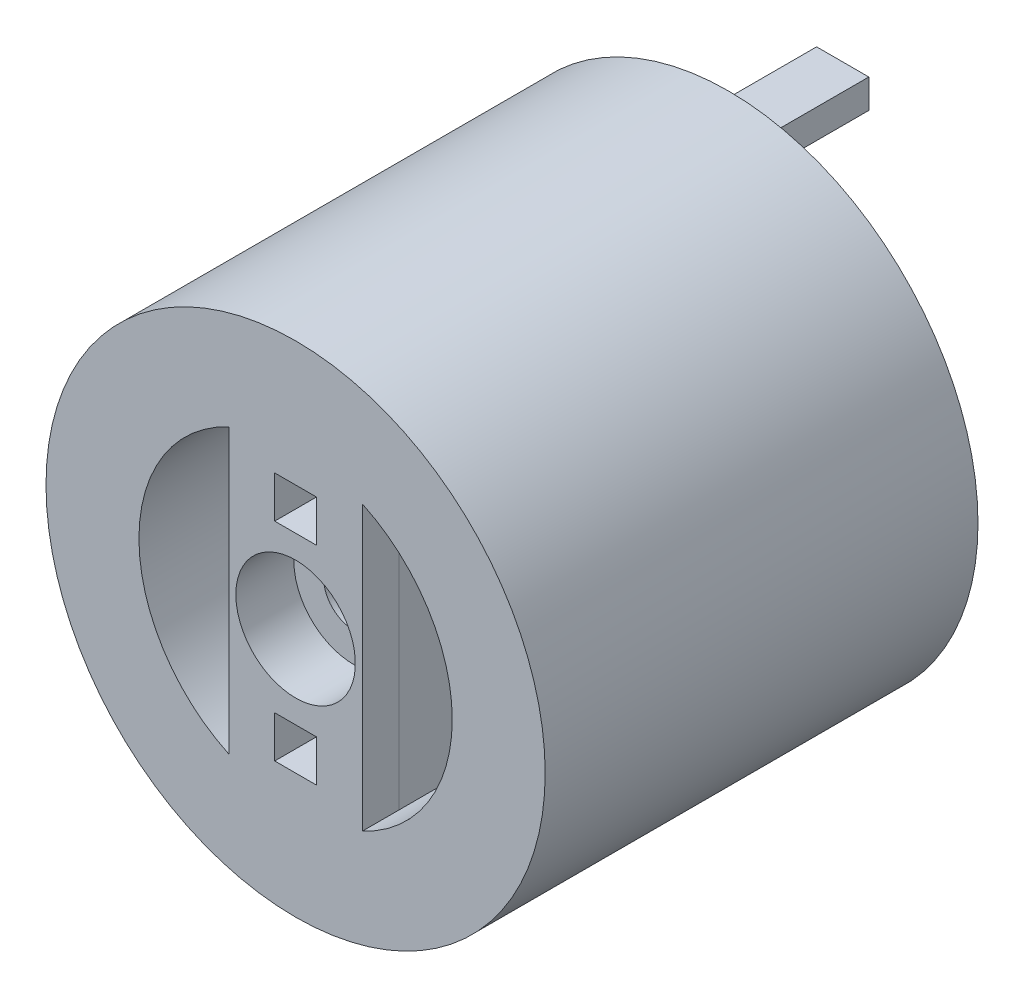
from build123d import *

# Parameters (mm, degrees)
SKETCH1_R                       = 21.51
BOSS_EXTRUDE1_DEPTH             = 37.3
SKETCH1_4_W                     = 4.5
SKETCH1_4_H                     = 2.5
BOSS_EXTRUDE2_DEPTH             = 9.85
CIRPATTERN2_COUNT               = 2
SKETCH4_W                       = 11.5
SKETCH4_H                       = 38.336712536
BOSS_EXTRUDE3_DEPTH             = 3.175
SKETCH8_W                       = 11.49524473
SKETCH8_H                       = 32.96460859
SKETCH8_R                       = 2.5875
BOSS_EXTRUDE4_DEPTH             = 5
CUT_EXTRUDE1_DEPTH              = 23
CIRPATTERN1_COUNT               = 2
CIRPATTERN1_ANGLE               = 53
CIRPATTERN1_THE_OTHER_WAY_COUNT = 2
CIRPATTERN1_THE_OTHER_WAY_ANGLE = 53
MIRROR2_COPY_1_DEPTH            = 23
MIRROR2_COPY_2_DEPTH            = 23
MIRROR2_COPY_3_DEPTH            = 23
CUT_EXTRUDE2_DEPTH              = 57.111341991
CUT_EXTRUDE2_DEPTH_BACK         = 5
SKETCH7_R                       = 5.15
CUT_EXTRUDE21_DEPTH             = 29


with BuildPart() as part:
    # Sketch1 → Boss-Extrude1 (new body)
    with BuildSketch(Plane.XY):
        Circle(SKETCH1_R)
        with BuildLine():
            ThreePointArc((0, 13.500344823), (9.546185373, 9.546185373), (13.500344823, 0))
            ThreePointArc((13.500344823, 0), (9.546185373, -9.546185373), (0, -13.500344823))
            ThreePointArc((0, -13.500344823), (-13.500344823, 0), (0, 13.500344823))
        make_face(mode=Mode.SUBTRACT)
    extrude(amount=BOSS_EXTRUDE1_DEPTH)

    # Sketch1<4> → Boss-Extrude2 (add)
    with BuildSketch(Plane.XY):
        with Locations((0, 17.500344823)):
            Rectangle(SKETCH1_4_W, SKETCH1_4_H)
    boss_extrude2 = extrude(amount=-BOSS_EXTRUDE2_DEPTH)

    # CirPattern2: Boss-Extrude2 ×2 about axis
    cirpattern2_axis = Axis((0, 0, 26.501422175), (0, 0, -1))
    for i in range(1, CIRPATTERN2_COUNT):
        add(boss_extrude2.rotate(cirpattern2_axis, i * 360 / CIRPATTERN2_COUNT))

    # Sketch4 → Boss-Extrude3 (add)
    with BuildSketch(Plane.XY.offset(37.3)):
        Rectangle(SKETCH4_W, SKETCH4_H)
    extrude(amount=-BOSS_EXTRUDE3_DEPTH)

    # Sketch8 → Boss-Extrude4 (add)
    with BuildSketch(Plane.XY.offset(34.125)):
        Rectangle(SKETCH8_W, SKETCH8_H)
        Circle(SKETCH8_R, mode=Mode.SUBTRACT)
    extrude(amount=-BOSS_EXTRUDE4_DEPTH)

    # Sketch1<3> → Cut-Extrude1 (cut)
    with BuildSketch(Plane.XY):
        Polygon((14.534826762, 4.999881098), (14.500344823, 0), (14.465862885, -4.999881098), (19.465743983, -5.034363037), (19.53470786, 4.96539916), align=None)
    cut_extrude1 = extrude(amount=CUT_EXTRUDE1_DEPTH, mode=Mode.SUBTRACT)

    # CirPattern1: Cut-Extrude1 ×2 about axis
    cirpattern1_axis = Axis((0, 0, 26.501422175), (0, 0, 1))
    for i in range(1, CIRPATTERN1_COUNT):
        add(cut_extrude1.rotate(cirpattern1_axis, i * CIRPATTERN1_ANGLE / (CIRPATTERN1_COUNT - 1)), mode=Mode.SUBTRACT)

    # CirPattern1 the other way: Cut-Extrude1 ×2 about axis
    cirpattern1_the_other_way_axis = Axis((0, 0, 26.501422175), (0, 0, -1))
    for i in range(1, CIRPATTERN1_THE_OTHER_WAY_COUNT):
        add(cut_extrude1.rotate(cirpattern1_the_other_way_axis, i * CIRPATTERN1_THE_OTHER_WAY_ANGLE / (CIRPATTERN1_THE_OTHER_WAY_COUNT - 1)), mode=Mode.SUBTRACT)

    # Mirror2 copy 1 sketch → Mirror2 copy 1 (cut)
    with BuildSketch(Plane(origin=(0, 0, 0), x_dir=(-0.6018150231520466, 0.798635510047294, 0), z_dir=(0, 0, 1))):
        Polygon((14.534826762, -4.999881098), (14.500344823, 0), (14.465862885, 4.999881098), (19.465743983, 5.034363037), (19.53470786, -4.96539916), align=None)
    extrude(amount=MIRROR2_COPY_1_DEPTH, mode=Mode.SUBTRACT)

    # Mirror2 copy 2 sketch → Mirror2 copy 2 (cut)
    with BuildSketch(Plane(origin=(0, 0, 0), x_dir=(-0.6018150231520466, -0.798635510047294, 0), z_dir=(0, 0, 1))):
        Polygon((14.534826762, -4.999881098), (14.500344823, 0), (14.465862885, 4.999881098), (19.465743983, 5.034363037), (19.53470786, -4.96539916), align=None)
    extrude(amount=MIRROR2_COPY_2_DEPTH, mode=Mode.SUBTRACT)

    # Mirror2 copy 3 sketch → Mirror2 copy 3 (cut)
    with BuildSketch(Plane(origin=(0, 0, 0), x_dir=(-1, 0, 0), z_dir=(0, 0, 1))):
        Polygon((14.534826762, -4.999881098), (14.500344823, 0), (14.465862885, 4.999881098), (19.465743983, 5.034363037), (19.53470786, -4.96539916), align=None)
    extrude(amount=MIRROR2_COPY_3_DEPTH, mode=Mode.SUBTRACT)

    # Sketch7 → Cut-Extrude2 (cut, two sides: drawn at the far end of the back side and taken through both)
    with BuildSketch(Plane.XY.offset(37.3).offset(-CUT_EXTRUDE2_DEPTH_BACK)):
        Circle(SKETCH7_R)
    extrude(amount=CUT_EXTRUDE2_DEPTH + CUT_EXTRUDE2_DEPTH_BACK, mode=Mode.SUBTRACT)

    # Sketch11 → Cut-Extrude21 (cut)
    with BuildSketch(Plane(origin=(0, 0, 37.3), x_dir=(-1, 0, 0), z_dir=(0, 0, -1))):
        Polygon((1.8, 10.75), (-1.8, 10.75), (-1.8, 7.15), (0, 7.15), (1.8, 7.15), align=None)
    cut_extrude21 = extrude(amount=CUT_EXTRUDE21_DEPTH, mode=Mode.SUBTRACT)

    # Mirror1: Cut-Extrude21 across plane
    add(cut_extrude21.mirror(Plane.ZX), mode=Mode.SUBTRACT)


solid = part.part
